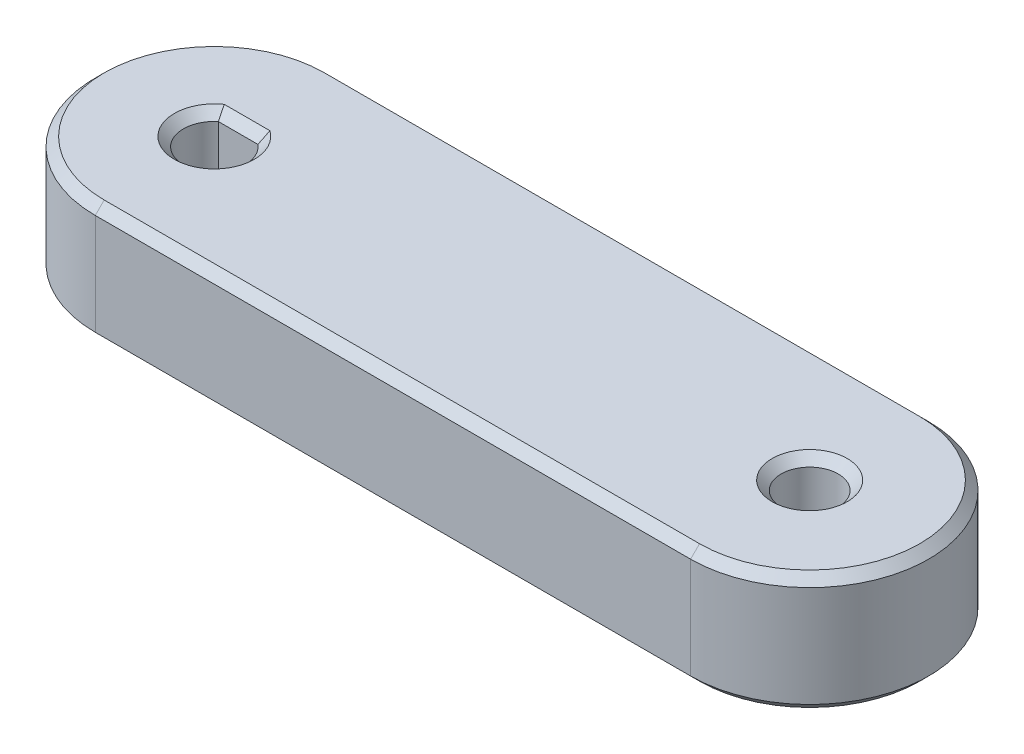
from build123d import *

# Parameters (mm, degrees)
SKETCH1_R           = 2.4
BOSS_EXTRUDE1_DEPTH = 10
CHAMFER1_SIZE       = 0.75


with BuildPart() as part:
    # Sketch1 → Boss-Extrude1 (new body)
    with BuildSketch(Plane(origin=(0, 0, 0), x_dir=(1, 0, 0), z_dir=(0, 1, 0))):
        with BuildLine():
            Line((-50, -10), (0, -10))
            ThreePointArc((0, -10), (10, 0), (0, 10))
            Line((0, 10), (-50, 10))
            ThreePointArc((-50, 10), (-60, 0), (-50, -10))
        make_face()
        with BuildLine():
            Line((-51.661324773, 2), (-48.338675227, 2))
            ThreePointArc((-48.338675227, 2), (-50, -2.6), (-51.661324773, 2))
        make_face(mode=Mode.SUBTRACT)
        Circle(SKETCH1_R, mode=Mode.SUBTRACT)
    extrude(amount=BOSS_EXTRUDE1_DEPTH)

    # Chamfer1
    chamfer1_edges = [part.edges().sort_by_distance(p)[0] for p in [
        (-2.4, 0, 0),
        (-2.4, 10, 0),
        (-25, 10, -10),
        (10, 10, 0),
        (-60, 10, 0),
        (-25, 10, 10),
        (-25, 0, -10),
        (10, 0, 0),
        (-60, 0, 0),
        (-25, 0, 10),
        (-50, 0, -2),
        (-50, 0, 2.6),
        (-50, 10, -2),
        (-50, 10, 2.6),
    ]]
    chamfer(chamfer1_edges, length=CHAMFER1_SIZE)


solid = part.part
